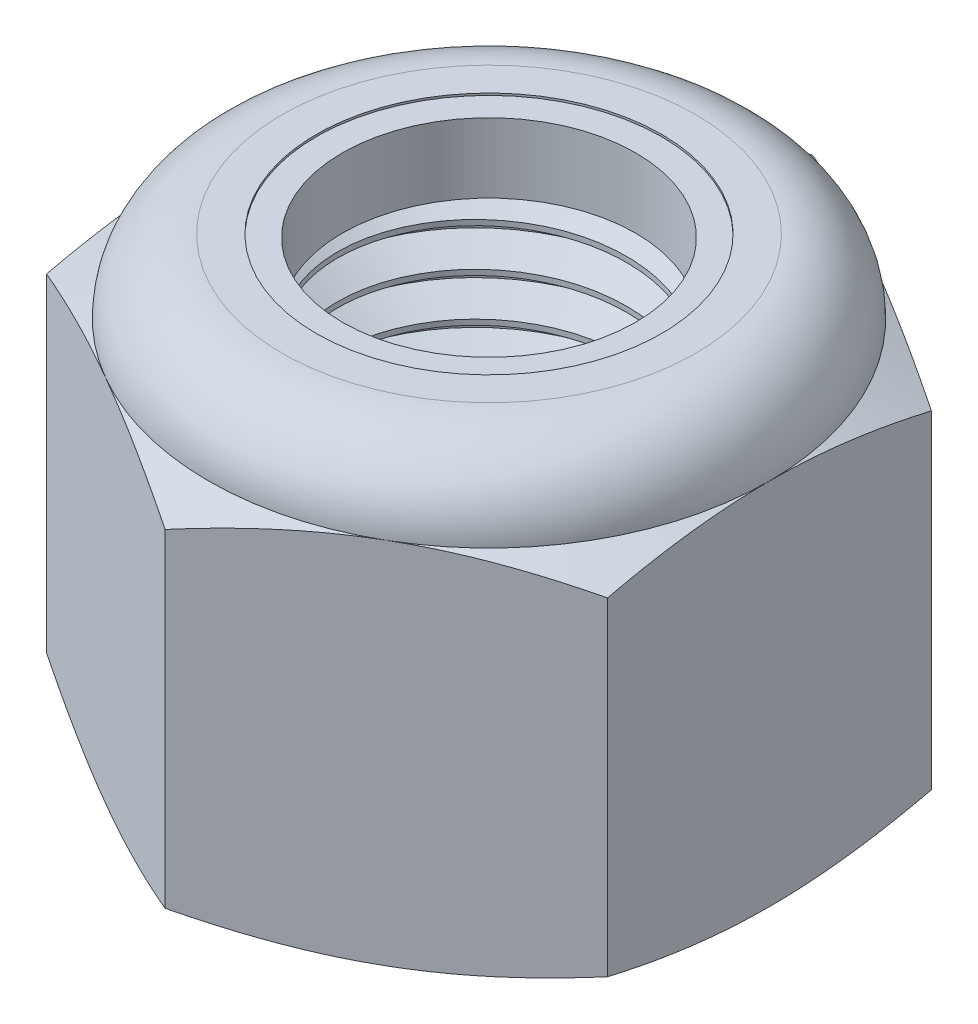
from build123d import *

# Parameters (mm, degrees)
SKETCH1_R        = 12.7
EXTRUDE1_DEPTH   = 32.54375
SKETCH2_W        = 12.7
SKETCH2_H        = 27.119791667
CUT_SWEEP1_PITCH = 3.175
SKETCH12_W       = 13.97
SKETCH12_H       = 27.119791667


with BuildPart() as part:
    # Sketch1 → Extrude1 (new body)
    with BuildSketch(Plane(origin=(0, 0, 0), x_dir=(1, 0, 0), z_dir=(0, 1, 0))):
        Polygon((0, 23.830132361), (-20.6375, 11.91506618), (-20.6375, -11.91506618), (0, -23.830132361), (20.6375, -11.91506618), (20.6375, 11.91506618), align=None)
        with Locations(Location((0, 0, 0), (0, 0, 270))):
            Circle(SKETCH1_R, mode=Mode.SUBTRACT)
    extrude(amount=EXTRUDE1_DEPTH)

    # Sketch5 → Cut-Revolve3 (revolve, cut)
    with BuildSketch(Plane(origin=(0, 0, 0), x_dir=(0, 0, -1), z_dir=(1, 0, 0))):
        with BuildLine():
            Line((0, 0), (20.6375, 0))
            Line((20.6375, 0), (23.830132361, 1.48874892))
            Line((23.830132361, 1.48874892), (23.830132361, 25.631042747))
            Line((23.830132361, 25.631042747), (20.6375, 27.119791667))
            ThreePointArc((20.6375, 27.119791667), (19.048859385, 30.955109385), (15.213541667, 32.54375))
            Line((15.213541667, 32.54375), (15.213541667, 33.81375))
            Line((15.213541667, 33.81375), (25.100132361, 33.81375))
            Line((25.100132361, 33.81375), (25.100132361, -1.27))
            Line((25.100132361, -1.27), (0, -1.27))
            Line((0, -1.27), (0, 0))
        make_face()
    revolve(axis=Axis((0, 0, 0), (0, 1, 0)), mode=Mode.SUBTRACT)

    # Sketch6 → Cut-Revolve4 (revolve, cut)
    with BuildSketch(Plane(origin=(0, 0, 0), x_dir=(0, 0, -1), z_dir=(1, 0, 0)), mode=Mode.PRIVATE) as cut_revolve4_sk:
        with BuildLine():
            Line((0, 27.119791667), (20.4851, 27.119791667))
            ThreePointArc((20.4851, 27.119791667), (18.941096312, 30.847346312), (15.213541667, 32.39135))
            Line((15.213541667, 32.39135), (7.606770833, 32.39135))
            Line((7.606770833, 32.39135), (7.606770833, 33.81375))
            Line((7.606770833, 33.81375), (0, 33.81375))
            Line((0, 33.81375), (0, 27.119791667))
        make_face()
    revolve(cut_revolve4_sk.sketch.rotate(Axis((0, 33.81375, 0), (0, -1, 0)), 180), axis=Axis((0, 33.81375, 0), (0, -1, 0)), mode=Mode.SUBTRACT)

    # Sketch4 → Cut-Revolve2 (revolve, cut)
    with BuildSketch(Plane(origin=(0, 0, 0), x_dir=(0, 0, -1), z_dir=(1, 0, 0))):
        Polygon((0, 27.119791667), (13.97, 27.119791667), (0, 20.605473682), align=None)
        Polygon((0, 6.514317984), (13.97, 0), (0, 0), align=None)
    revolve(axis=Axis((0, 0, 0), (0, 1, 0)), mode=Mode.SUBTRACT)

    # Sketch12 → Revolve4 (revolve)
    with BuildSketch(Plane(origin=(0, 0, 0), x_dir=(0, 0, -1), z_dir=(1, 0, 0)), mode=Mode.PRIVATE) as revolve4_sk:
        with Locations((6.985, 13.559895834)):
            Rectangle(SKETCH12_W, SKETCH12_H)
    revolve(revolve4_sk.sketch.rotate(Axis((0, 0, 0), (0, 1, 0)), 277.213743497), axis=Axis((0, 0, 0), (0, 1, 0)))


with BuildPart() as body_2:
    # Sketch7 → Revolve2 (revolve)
    with BuildSketch(Plane(origin=(0, 0, 0), x_dir=(0, 0, -1), z_dir=(1, 0, 0))):
        with BuildLine():
            Line((10.795, 27.195991667), (20.40834116, 27.195991667))
            ThreePointArc((20.40834116, 27.195991667), (18.860174491, 30.820307476), (15.213541667, 32.31515))
            Line((15.213541667, 32.31515), (10.795, 32.31515))
            Line((10.795, 32.31515), (10.795, 27.195991667))
        make_face()
    revolve(axis=Axis((0, 27.195991667, 0), (0, 1, 0)))


with BuildPart() as body_3:
    # Sketch2 → Revolve1 (revolve)
    with BuildSketch(Plane(origin=(0, 0, 0), x_dir=(0, 0, -1), z_dir=(1, 0, 0))):
        with Locations((6.35, 13.559895834)):
            Rectangle(SKETCH2_W, SKETCH2_H)
    revolve(axis=Axis((0, -12.7, 0), (0, 1, 0)))

    # Cut-Sweep1: the profile of Sketch9 screwed along a right-hand helix of 11.25 turns, 12 arcs to a turn; built about Z, then put on its axis
    cut_sweep1_z = Axis((0, 0, 0), (0, 0, 1))
    cut_sweep1_corners = [(13.043703832, 0, 0.1984375), (12.871851916, 0, -2.87734375), (10.637777007, 0, -1.5875), (10.637777007, 0, -1.190625)]
    with BuildLine(mode=Mode.PRIVATE) as cut_sweep1_profile:
        Line(cut_sweep1_corners[0], cut_sweep1_corners[1])
        Line(cut_sweep1_corners[1], cut_sweep1_corners[2])
        Line(cut_sweep1_corners[2], cut_sweep1_corners[3])
        Line(cut_sweep1_corners[3], cut_sweep1_corners[0])
    cut_sweep1_cap = Face(cut_sweep1_profile.wire())
    cut_sweep1_turn_angles = [0, 15, 30, 45, 60, 75, 90, 105, 120, 135, 150, 165, 180, 195, 210, 225, 240, 255, 270, 285, 300, 315, 330, 345, 360]
    cut_sweep1_turn_weights = [1, 0.9659258262890683, 1, 0.9659258262890683, 1, 0.9659258262890683, 1, 0.9659258262890683, 1, 0.9659258262890683, 1, 0.9659258262890683, 1, 0.9659258262890683, 1, 0.9659258262890683, 1, 0.9659258262890683, 1, 0.9659258262890683, 1, 0.9659258262890683, 1, 0.9659258262890683, 1]
    cut_sweep1_turn_rails = [Edge.make_bspline([Vector(p[0], p[1], 0).rotate(cut_sweep1_z, cut_sweep1_turn_angles[k]) / cut_sweep1_turn_weights[k] + Vector(0, 0, p[2] + CUT_SWEEP1_PITCH * cut_sweep1_turn_angles[k] / 360) for k in range(25)], [0, 0, 0, 1, 1, 2, 2, 3, 3, 4, 4, 5, 5, 6, 6, 7, 7, 8, 8, 9, 9, 10, 10, 11, 11, 12, 12, 12], 2, cut_sweep1_turn_weights) for p in cut_sweep1_corners]
    cut_sweep1_turn_sides = [Face.make_surface_from_curves(cut_sweep1_turn_rails[p[0]], cut_sweep1_turn_rails[p[1]]) for p in [(0, 1), (1, 2), (2, 3), (3, 0)]]
    cut_sweep1_last_angles = [3960, 3975, 3990, 4005, 4020, 4035, 4050]
    cut_sweep1_last_weights = [1, 0.9659258262890683, 1, 0.9659258262890683, 1, 0.9659258262890549, 1]
    cut_sweep1_last_rails = [Edge.make_bspline([Vector(p[0], p[1], 0).rotate(cut_sweep1_z, cut_sweep1_last_angles[k]) / cut_sweep1_last_weights[k] + Vector(0, 0, p[2] + CUT_SWEEP1_PITCH * cut_sweep1_last_angles[k] / 360) for k in range(7)], [0, 0, 0, 1, 1, 2, 2, 3, 3, 3], 2, cut_sweep1_last_weights) for p in cut_sweep1_corners]
    cut_sweep1_last_sides = [Face.make_surface_from_curves(cut_sweep1_last_rails[p[0]], cut_sweep1_last_rails[p[1]]) for p in [(0, 1), (1, 2), (2, 3), (3, 0)]]
    cut_sweep1 = Plane(origin=(0, 27.119791667, 0), x_dir=(0, 0, -1), z_dir=(0, -1, 0)) * Solid(Shell([*[p.moved(Location((0, 0, CUT_SWEEP1_PITCH * i))) for i in range(11) for p in cut_sweep1_turn_sides], *cut_sweep1_last_sides, cut_sweep1_cap, cut_sweep1_cap.rotate(cut_sweep1_z, 4050).moved(Location((0, 0, CUT_SWEEP1_PITCH * 4050 / 360)))]))
    add(cut_sweep1, mode=Mode.SUBTRACT)

    # Sketch11 → Revolve3 (revolve)
    with BuildSketch(Plane(origin=(0, 0, 0), x_dir=(0, 0, -1), z_dir=(1, 0, 0))):
        Polygon((0, 0), (13.97, 0), (0, 6.514317984), align=None)
    revolve(axis=Axis((0, 32.54375, 0), (0, -1, 0)))


with BuildPart() as part_1:
    add(part.part)

    # Combine1: cut body 3
    add(body_3.part, mode=Mode.SUBTRACT)


solid = Compound([body_2.part, part_1.part])
